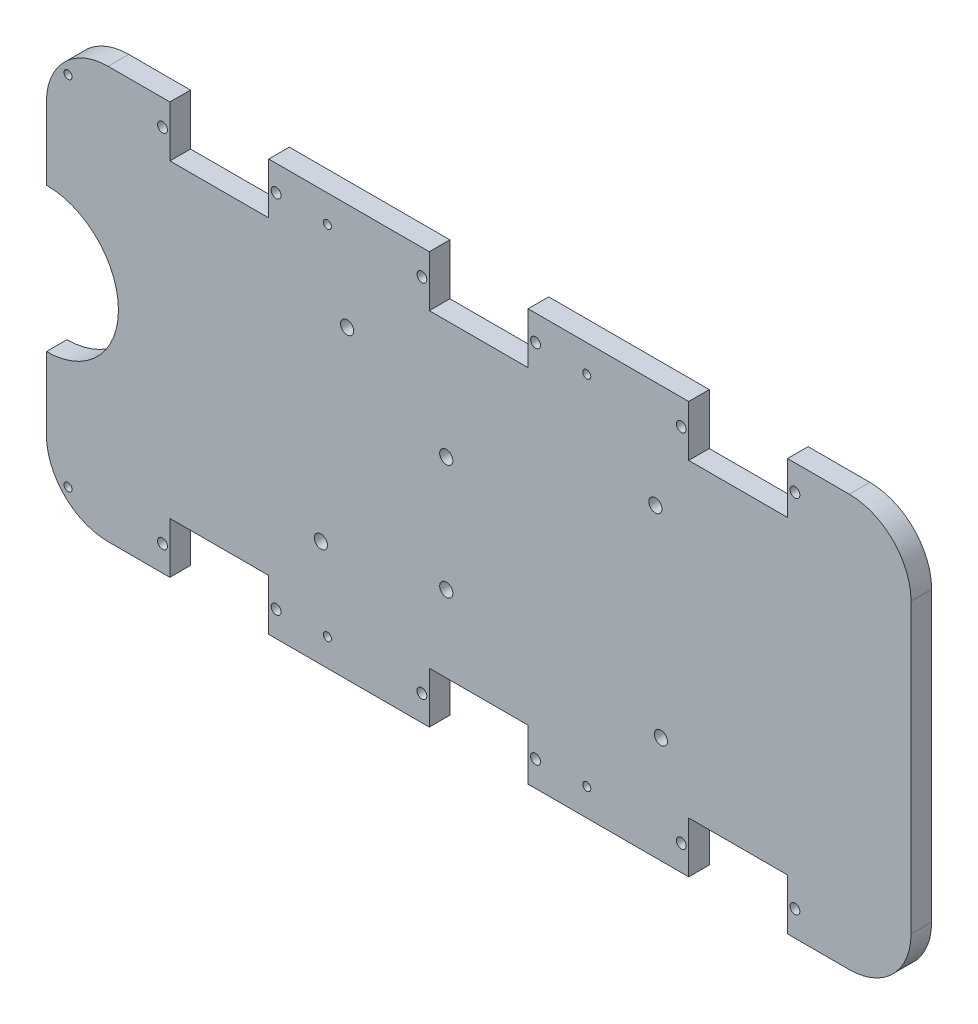
from build123d import *

# Parameters (mm, degrees)
BOSS_EXTRUDE2_DEPTH = 5
SKETCH2_W           = 24
SKETCH2_H           = 12.4
CUT_EXTRUDE1_DEPTH  = 5
SKETCH3_R           = 1.2
CUT_EXTRUDE2_DEPTH  = 5
SKETCH5_R           = 0.975
CUT_EXTRUDE3_DEPTH  = 10
SKETCH6_R           = 17.5
CUT_EXTRUDE4_DEPTH  = 10
SKETCH8_R           = 1.6
CUT_EXTRUDE5_DEPTH  = 10
BOSS_EXTRUDE3_DEPTH = 17.7
SKETCH12_R          = 1.2
CUT_EXTRUDE6_DEPTH  = 5


with BuildPart() as part:
    # Sketch1 → Boss-Extrude2 (new body)
    with BuildSketch(Plane.XY):
        with BuildLine():
            Line((-90, -50), (90, -50))
            ThreePointArc((90, -50), (100.606601718, -45.606601718), (105, -35))
            Line((105, -35), (105, 35))
            ThreePointArc((105, 35), (100.606601718, 45.606601718), (90, 50))
            Line((90, 50), (-90, 50))
            ThreePointArc((-90, 50), (-100.606601718, 45.606601718), (-105, 35))
            Line((-105, 35), (-105, -35))
            ThreePointArc((-105, -35), (-100.606601718, -45.606601718), (-90, -50))
        make_face()
    extrude(amount=BOSS_EXTRUDE2_DEPTH)

    # Sketch2 → Cut-Extrude1 (cut)
    with BuildSketch(Plane.XY.offset(5)):
        with Locations((63, -43.8)):
            Rectangle(SKETCH2_W, SKETCH2_H)
        with Locations((-63, 43.8)):
            Rectangle(SKETCH2_W, SKETCH2_H)
        with Locations((0, 43.8)):
            Rectangle(SKETCH2_W, SKETCH2_H)
        with Locations((63, 43.8)):
            Rectangle(SKETCH2_W, SKETCH2_H)
        with Locations((0, -43.8)):
            Rectangle(SKETCH2_W, SKETCH2_H)
        with Locations((-63, -43.8)):
            Rectangle(SKETCH2_W, SKETCH2_H)
    extrude(amount=-CUT_EXTRUDE1_DEPTH, mode=Mode.SUBTRACT)

    # Sketch3 → Cut-Extrude2 (cut)
    with BuildSketch(Plane.XY.offset(5)):
        with Locations((-76.8, 43.8)):
            Circle(SKETCH3_R)
        with Locations((-49.2, 43.8)):
            Circle(SKETCH3_R)
        with Locations((-13.8, 43.8)):
            Circle(SKETCH3_R)
        with Locations((13.8, 43.8)):
            Circle(SKETCH3_R)
        with Locations((49.2, 43.8)):
            Circle(SKETCH3_R)
        with Locations((76.8, 43.8)):
            Circle(SKETCH3_R)
        with Locations((-76.8, -43.8)):
            Circle(SKETCH3_R)
        with Locations((-49.2, -43.8)):
            Circle(SKETCH3_R)
        with Locations((-13.8, -43.8)):
            Circle(SKETCH3_R)
        with Locations((13.8, -43.8)):
            Circle(SKETCH3_R)
        with Locations((49.2, -43.8)):
            Circle(SKETCH3_R)
        with Locations((76.8, -43.8)):
            Circle(SKETCH3_R)
    extrude(amount=-CUT_EXTRUDE2_DEPTH, mode=Mode.SUBTRACT)

    # Sketch5 → Cut-Extrude3 (cut)
    with BuildSketch(Plane.XY.offset(5)):
        with Locations((-36.75, 43.360200931)):
            Circle(SKETCH5_R)
        with Locations((26.25, 43.360200931)):
            Circle(SKETCH5_R)
        with Locations((26.25, -43.360200931)):
            Circle(SKETCH5_R)
        with Locations((-36.75, -43.360200931)):
            Circle(SKETCH5_R)
        with Locations((-99.75, 43.360200931)):
            Circle(SKETCH5_R)
        with Locations((-99.75, -43.360200931)):
            Circle(SKETCH5_R)
    extrude(amount=-CUT_EXTRUDE3_DEPTH, mode=Mode.SUBTRACT)

    # Sketch6 → Cut-Extrude4 (cut)
    with BuildSketch(Plane.XY.offset(5)):
        with Locations((-105, 0)):
            Circle(SKETCH6_R)
    extrude(amount=-CUT_EXTRUDE4_DEPTH, mode=Mode.SUBTRACT)

    # Sketch8 → Cut-Extrude5 (cut)
    with BuildSketch(Plane(origin=(0, 0, 0), x_dir=(-1, 0, 0), z_dir=(0, 0, -1))):
        with Locations((31.97, 24.11)):
            Circle(SKETCH8_R)
        with Locations((38.33, -24.11)):
            Circle(SKETCH8_R)
        with Locations((7.88, 8.88)):
            Circle(SKETCH8_R)
        with Locations((7.88, -19.03)):
            Circle(SKETCH8_R)
        with Locations((-42.91, 24.11)):
            Circle(SKETCH8_R)
        with Locations((-44.24, -24.11)):
            Circle(SKETCH8_R)
    extrude(amount=-CUT_EXTRUDE5_DEPTH, mode=Mode.SUBTRACT)

    # Sketch10 → Boss-Extrude3 (add)
    with BuildSketch(Plane(origin=(0, 0, 0), x_dir=(-1, 0, 0), z_dir=(0, 0, -1))):
        Polygon((76.290147782, 0), (71.290147782, 0), (71.290147782, -11.5), (58.890147782, -11.5), (58.890147782, 11.5), (71.290147782, 11.5), (71.290147782, 16.5), (53.890147782, 16.5), (53.890147782, -16.5), (76.290147782, -16.5), align=None)
    extrude(amount=BOSS_EXTRUDE3_DEPTH)

    # Sketch12 → Cut-Extrude6 (cut)
    with BuildSketch(Plane(origin=(0, 0, -17.7), x_dir=(-1, 0, 0), z_dir=(0, 0, -1))):
        with Locations((65.090147782, -13.8)):
            Circle(SKETCH12_R)
        with Locations((65.090147782, 13.8)):
            Circle(SKETCH12_R)
    extrude(amount=-CUT_EXTRUDE6_DEPTH, mode=Mode.SUBTRACT)


solid = part.part
